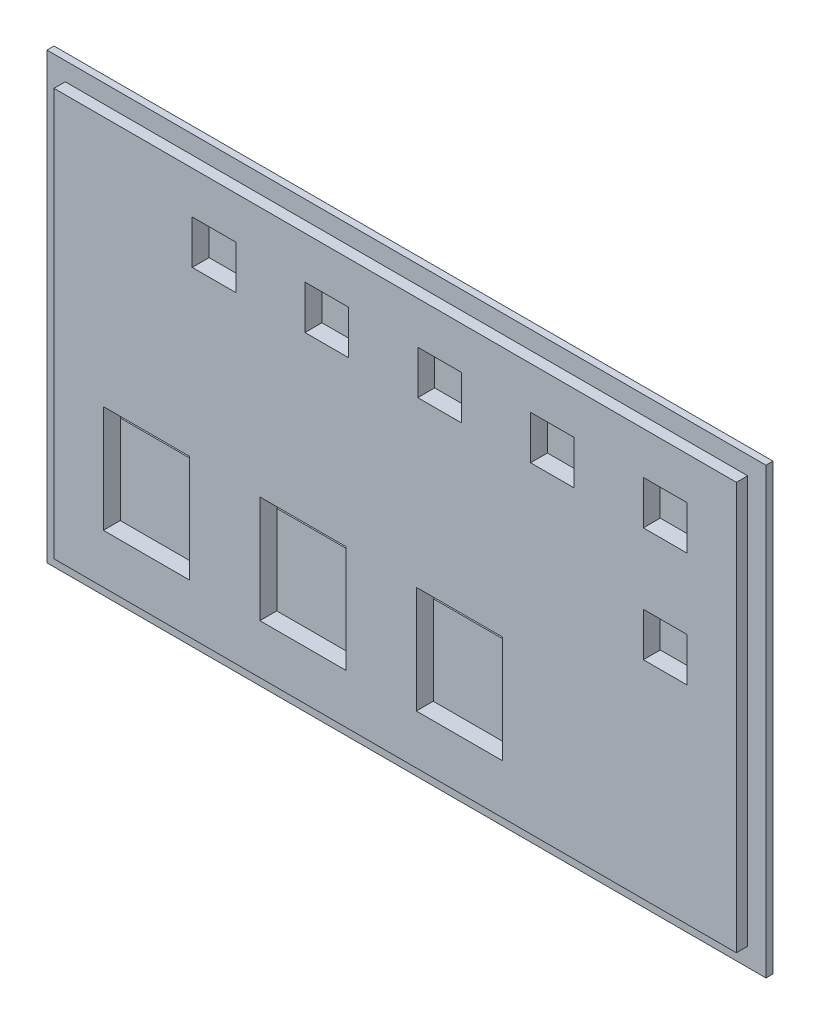
from build123d import *

# Parameters (mm, degrees)
SKICA1_W                = 96.8
SKICA1_H                = 57.8
SKICA1_W_2              = 6.2
SKICA1_H_2              = 6.2
P_IDAT_VYSUNUT_M1_DEPTH = 2.6
SKICA1_3_W              = 102
SKICA1_3_H              = 63
SKICA1_3_W_2            = 96.8
SKICA1_3_H_2            = 57.8
P_IDAT_VYSUNUT_M2_DEPTH = 1
SKICA1_5_W              = 12.2
SKICA1_5_H              = 12.6
SKICA1_5_W_2            = 6.2
SKICA1_5_H_2            = 6.2
P_IDAT_VYSUNUT_M3_DEPTH = 0.2


with BuildPart() as part:
    # Skica1 → Přidat vysunutím1 (new body)
    with BuildSketch(Plane.XY):
        with Locations((51, 31.5)):
            Rectangle(SKICA1_W, SKICA1_H)
        Polygon((9.6, 9.6), (9.6, 22.2), (9.6, 24.8), (21.8, 24.8), (21.8, 22.2), (21.8, 9.6), align=None, mode=Mode.SUBTRACT)
        Polygon((31.8, 22.2), (31.8, 24.8), (44, 24.8), (44, 22.2), (44, 9.6), (31.8, 9.6), align=None, mode=Mode.SUBTRACT)
        Polygon((54, 22.2), (54, 24.8), (66.2, 24.8), (66.2, 22.2), (66.2, 9.6), (54, 9.6), align=None, mode=Mode.SUBTRACT)
        with Locations((25.3, 51.3)):
            Rectangle(SKICA1_W_2, SKICA1_H_2, mode=Mode.SUBTRACT)
        with Locations((41.3, 51.3)):
            Rectangle(SKICA1_W_2, SKICA1_H_2, mode=Mode.SUBTRACT)
        with Locations((89.3, 35.1)):
            Rectangle(SKICA1_W_2, SKICA1_H_2, mode=Mode.SUBTRACT)
        with Locations((57.3, 51.3)):
            Rectangle(SKICA1_W_2, SKICA1_H_2, mode=Mode.SUBTRACT)
        with Locations((73.3, 51.3)):
            Rectangle(SKICA1_W_2, SKICA1_H_2, mode=Mode.SUBTRACT)
        with Locations((89.3, 51.3)):
            Rectangle(SKICA1_W_2, SKICA1_H_2, mode=Mode.SUBTRACT)
    extrude(amount=P_IDAT_VYSUNUT_M1_DEPTH)

    # Skica1<3> → Přidat vysunutím2 (add)
    with BuildSketch(Plane.XY):
        with Locations((51, 31.5)):
            Rectangle(SKICA1_3_W, SKICA1_3_H)
        with Locations((51, 31.5)):
            Rectangle(SKICA1_3_W_2, SKICA1_3_H_2, mode=Mode.SUBTRACT)
    extrude(amount=P_IDAT_VYSUNUT_M2_DEPTH)

    # Skica1<5> → Přidat vysunutím3 (add)
    with BuildSketch(Plane.XY):
        with Locations((15.7, 15.9)):
            Rectangle(SKICA1_5_W, SKICA1_5_H)
        with Locations((25.3, 51.3)):
            Rectangle(SKICA1_5_W_2, SKICA1_5_H_2)
        with Locations((41.3, 51.3)):
            Rectangle(SKICA1_5_W_2, SKICA1_5_H_2)
        with Locations((57.3, 51.3)):
            Rectangle(SKICA1_5_W_2, SKICA1_5_H_2)
        with Locations((73.3, 51.3)):
            Rectangle(SKICA1_5_W_2, SKICA1_5_H_2)
        with Locations((89.3, 51.3)):
            Rectangle(SKICA1_5_W_2, SKICA1_5_H_2)
        with Locations((37.9, 15.9)):
            Rectangle(SKICA1_5_W, SKICA1_5_H)
        with Locations((60.1, 15.9)):
            Rectangle(SKICA1_5_W, SKICA1_5_H)
        with Locations((89.3, 35.1)):
            Rectangle(SKICA1_5_W_2, SKICA1_5_H_2)
    extrude(amount=P_IDAT_VYSUNUT_M3_DEPTH)


solid = part.part
